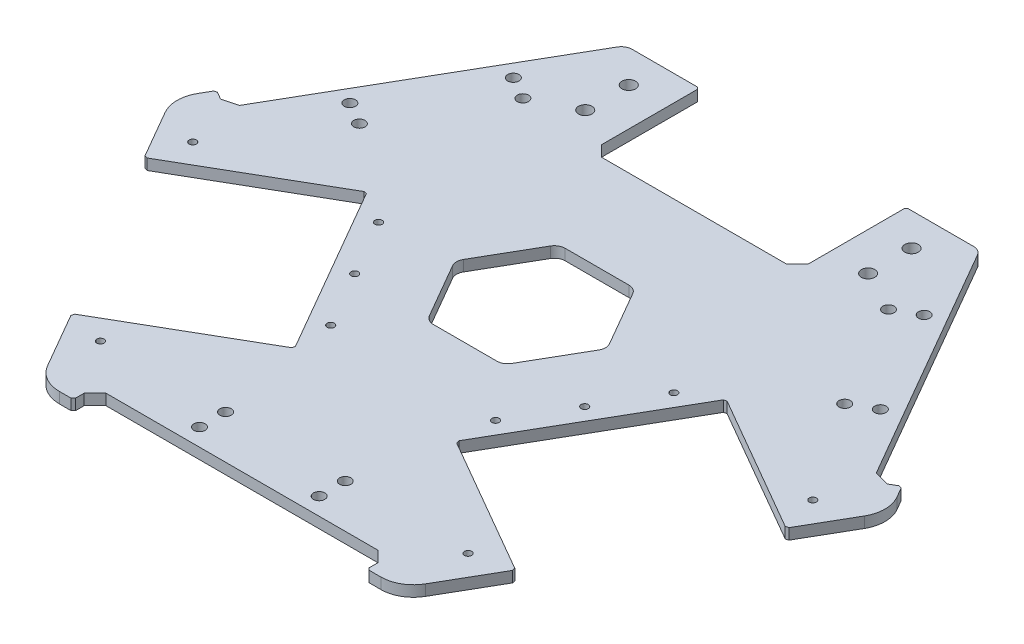
from build123d import *

# Parameters (mm, degrees)
EXTRUDE_1_DEPTH           = 5
SKETCH_2_W                = 135
SKETCH_2_H                = 10
CUT_EXTRUDE_1_DEPTH       = 219.331742997
SKETCH_8_R                = 2.6
CUT_EXTRUDE_6_DEPTH       = 219.331742997
PATTERN_CIRCULAR_1_COUNT  = 3
CUT_EXTRUDE_17_DEPTH      = 219.331742997
CUT_EXTRUDE_17_DEPTH_BACK = 219.331742997
CUT_EXTRUDE_3_DEPTH       = 219.331742997
CUT_EXTRUDE_4_DEPTH       = 219.331742997
SKETCH_9_R                = 1.65
CUT_EXTRUDE_7_DEPTH       = 219.331742997
FILLET_1_R                = 15
SKETCH_34_R               = 3.1
CUT_EXTRUDE_18_DEPTH      = 217.583395238
PATTERN_LINEAR_1_COUNT    = 2
PATTERN_LINEAR_1_PITCH    = 20
SKETCH_35_W               = 95
SKETCH_35_H               = 50
CUT_EXTRUDE_19_DEPTH      = 217.583395238
CHAMFER_2_SIZE            = 1
CHAMFER_4_SIZE            = 5
FILLET_2_R                = 5
FILLET_3_R                = 5
M4X0_7_4_D                = 3.3
MIRROR_2_COPY_1_SKETCH_R  = 3.1
MIRROR_2_COPY_1_DEPTH     = 217.583395238
MIRROR_2_COPY_2_SKETCH_R  = 3.1
MIRROR_2_COPY_2_DEPTH     = 217.583395238


with BuildPart() as part:
    # 草圖1 → 填料-伸長1 (new body)
    with BuildSketch(Plane(origin=(0, 0, 0), x_dir=(1, 0, 0), z_dir=(0, 1, 0))):
        Polygon((82.5, 142.894191624), (-82.5, 142.894191624), (-165, 0), (-82.5, -142.894191624), (82.5, -142.894191624), (165, 0), align=None)
    extrude(amount=EXTRUDE_1_DEPTH)

    # 草圖2 → 除料-伸長1 (cut, through all)
    with BuildSketch(Plane(origin=(0, 5, 0), x_dir=(1, 0, 0), z_dir=(0, 1, 0))):
        with Locations((0, -137.894191624)):
            Rectangle(SKETCH_2_W, SKETCH_2_H)
    cut_extrude_1 = extrude(amount=-CUT_EXTRUDE_1_DEPTH, mode=Mode.SUBTRACT)

    # 草圖8 → 除料-伸長6 (cut, through all)
    with BuildSketch(Plane(origin=(0, 5, 0), x_dir=(1, 0, 0), z_dir=(0, 1, 0))):
        with Locations((-27.5, -124.894191624)):
            Circle(SKETCH_8_R)
        with Locations((27.5, -124.894191624)):
            Circle(SKETCH_8_R)
        with Locations((-27.5, -112.894191624)):
            Circle(SKETCH_8_R)
        with Locations((27.5, -112.894191624)):
            Circle(SKETCH_8_R)
    cut_extrude_6 = extrude(amount=-CUT_EXTRUDE_6_DEPTH, mode=Mode.SUBTRACT)

    # 環狀複製排列1: 除料-伸長1, 除料-伸長6 ×3 about axis
    pattern_circular_1_axis = Axis((0, -0.25, 0), (0, 1, 0))
    add([cut_extrude_1.rotate(pattern_circular_1_axis, i * 360 / PATTERN_CIRCULAR_1_COUNT) for i in range(1, PATTERN_CIRCULAR_1_COUNT)], mode=Mode.SUBTRACT)
    add([cut_extrude_6.rotate(pattern_circular_1_axis, i * 360 / PATTERN_CIRCULAR_1_COUNT) for i in range(1, PATTERN_CIRCULAR_1_COUNT)], mode=Mode.SUBTRACT)

    # 草圖23 → 除料-伸長17 (cut, two sides: drawn at the far end of the back side and taken through both)
    with BuildSketch(Plane(origin=(0, 5, 0), x_dir=(1, 0, 0), z_dir=(0, 1, 0)).offset(-CUT_EXTRUDE_17_DEPTH_BACK)):
        Polygon((-819.073324736, 124.903810568), (-81.339745962, 124.903810568), (81.339745962, 124.903810568), (819.073324736, 124.903810568), (819.073324736, 1600.370968116), (-819.073324736, 1600.370968116), align=None)
    extrude(amount=CUT_EXTRUDE_17_DEPTH + CUT_EXTRUDE_17_DEPTH_BACK, mode=Mode.SUBTRACT)

    # 草圖4 → 除料-伸長3 (cut, through all)
    with BuildSketch(Plane(origin=(0, 5, 0), x_dir=(1, 0, 0), z_dir=(0, 1, 0))):
        Polygon((17.5, 30.310889132), (-17.5, 30.310889132), (-35, 0), (-17.5, -30.310889132), (17.5, -30.310889132), (35, 0), align=None)
    extrude(amount=-CUT_EXTRUDE_3_DEPTH, mode=Mode.SUBTRACT)

    # 草圖5 → 除料-伸長4 (cut, through all)
    with BuildSketch(Plane(origin=(0, 5, 0), x_dir=(1, 0, 0), z_dir=(0, 1, 0))):
        Polygon((-147.5, -30.310889132), (-102, -109.119200877), (-37.048094716, -71.619200877), (-82.548094716, 7.189110868), align=None)
    cut_extrude_4 = extrude(amount=-CUT_EXTRUDE_4_DEPTH, mode=Mode.SUBTRACT)

    # 草圖9 → 除料-伸長7 (cut, through all)
    with BuildSketch(Plane(origin=(0, 5, 0), x_dir=(1, 0, 0), z_dir=(0, 1, 0))):
        with Locations((-84.491669751, -113.444518424)):
            Circle(SKETCH_9_R)
        with Locations((-142.491669751, -12.985571585)):
            Circle(SKETCH_9_R)
    cut_extrude_7 = extrude(amount=-CUT_EXTRUDE_7_DEPTH, mode=Mode.SUBTRACT)

    # 鏡射1: 除料-伸長4, 除料-伸長7 across plane
    add(cut_extrude_4.mirror(Plane(origin=(0, 0, 0), x_dir=(0, 0, 1), z_dir=(1, 0, 0))), mode=Mode.SUBTRACT)
    add(cut_extrude_7.mirror(Plane(origin=(0, 0, 0), x_dir=(0, 0, 1), z_dir=(1, 0, 0))), mode=Mode.SUBTRACT)

    # 圓角1
    fillet_1_edges = [part.edges().sort_by_distance(p)[0] for p in [
        (165, 2.5, 0),
        (82.5, 2.5, 142.894191624),
        (-165, 2.5, 0),
        (-82.5, 2.5, 142.894191624),
    ]]
    fillet(fillet_1_edges, radius=FILLET_1_R)

    # 草圖34 → 除料-伸長18 (cut, through all)
    with BuildSketch(Plane(origin=(0, 5, 0), x_dir=(1, 0, 0), z_dir=(0, 1, 0))):
        with Locations((-65, 109.903810568)):
            Circle(SKETCH_34_R)
    cut_extrude_18 = extrude(amount=-CUT_EXTRUDE_18_DEPTH, mode=Mode.SUBTRACT)

    # 直線複製排列1: 除料-伸長18 ×2
    with Locations(*[(0, 0, i * PATTERN_LINEAR_1_PITCH) for i in range(1, PATTERN_LINEAR_1_COUNT)]):
        add(cut_extrude_18, mode=Mode.SUBTRACT)

    # 草圖35 → 除料-伸長19 (cut, through all)
    with BuildSketch(Plane(origin=(0, 5, 0), x_dir=(1, 0, 0), z_dir=(0, 1, 0))):
        with Locations((0, 99.903810568)):
            Rectangle(SKETCH_35_W, SKETCH_35_H)
    extrude(amount=-CUT_EXTRUDE_19_DEPTH, mode=Mode.SUBTRACT)

    # 導角2
    chamfer_2_edges = [part.edges().sort_by_distance(p)[0] for p in [
        (-37.048094716, 2.5, 71.619200877),
        (-82.548094716, 2.5, -7.189110868),
        (-157.5, 2.5, -12.990381057),
        (157.5, 2.5, -12.990381057),
        (147.5, 2.5, 30.310889132),
        (82.548094716, 2.5, -7.189110868),
        (37.048094716, 2.5, 71.619200877),
        (102, 2.5, 109.119200877),
        (67.5, 2.5, 142.894191624),
        (-67.5, 2.5, 142.894191624),
        (-102, 2.5, 109.119200877),
        (-147.5, 2.5, 30.310889132),
        (-47.5, 2.5, -124.903810568),
        (47.5, 2.5, -124.903810568),
    ]]
    chamfer(chamfer_2_edges, length=CHAMFER_2_SIZE)

    # 導角4
    chamfer_4_edges = [part.edges().sort_by_distance(p)[0] for p in [
        (148.839745962, 2.5, -7.990381057),
        (67.5, 2.5, 132.894191624),
        (-67.5, 2.5, 132.894191624),
        (-148.839745962, 2.5, -7.990381057),
        (47.5, 2.5, -74.903810568),
        (-47.5, 2.5, -74.903810568),
    ]]
    chamfer(chamfer_4_edges, length=CHAMFER_4_SIZE)

    # 圓角2
    fillet_2_edges = [part.edges().sort_by_distance(p)[0] for p in [
        (-81.339745962, 2.5, -124.903810568),
        (81.339745962, 2.5, -124.903810568),
    ]]
    fillet(fillet_2_edges, radius=FILLET_2_R)

    # 圓角3
    fillet_3_edges = [part.edges().sort_by_distance(p)[0] for p in [
        (17.5, 2.5, 30.310889132),
        (35, 2.5, 0),
        (17.5, 2.5, -30.310889132),
        (-17.5, 2.5, 30.310889132),
        (-35, 2.5, 0),
        (-17.5, 2.5, -30.310889132),
    ]]
    fillet(fillet_3_edges, radius=FILLET_3_R)

    # M4x0.7 螺紋孔4 (through all)
    with Locations(Plane(origin=(0, 5, 0), x_dir=(1, 0, 0), z_dir=(0, 1, 0))):
        with Locations((-67.869891486, -2.234282891), (-52.869891486, -28.215045005), (-37.869891486, -54.195807118)):
            m4x0_7_4 = Hole(M4X0_7_4_D / 2)

    # 鏡射2: M4x0.7 螺紋孔4 across plane
    add(m4x0_7_4.mirror(Plane(origin=(0, 0, 0), x_dir=(0, 0, 1), z_dir=(1, 0, 0))), mode=Mode.SUBTRACT)

    # 鏡射2 copy 1 sketch → 鏡射2 copy 1 (cut, through all)
    with BuildSketch(Plane(origin=(0, 5, 20), x_dir=(-1, 0, 0), z_dir=(0, 1, 0))):
        with Locations((-65, -109.903810568)):
            Circle(MIRROR_2_COPY_1_SKETCH_R)
    extrude(amount=-MIRROR_2_COPY_1_DEPTH, mode=Mode.SUBTRACT)

    # 鏡射2 copy 2 sketch → 鏡射2 copy 2 (cut, through all)
    with BuildSketch(Plane(origin=(0, 5, 0), x_dir=(-1, 0, 0), z_dir=(0, 1, 0))):
        with Locations((-65, -109.903810568)):
            Circle(MIRROR_2_COPY_2_SKETCH_R)
    extrude(amount=-MIRROR_2_COPY_2_DEPTH, mode=Mode.SUBTRACT)


solid = part.part
